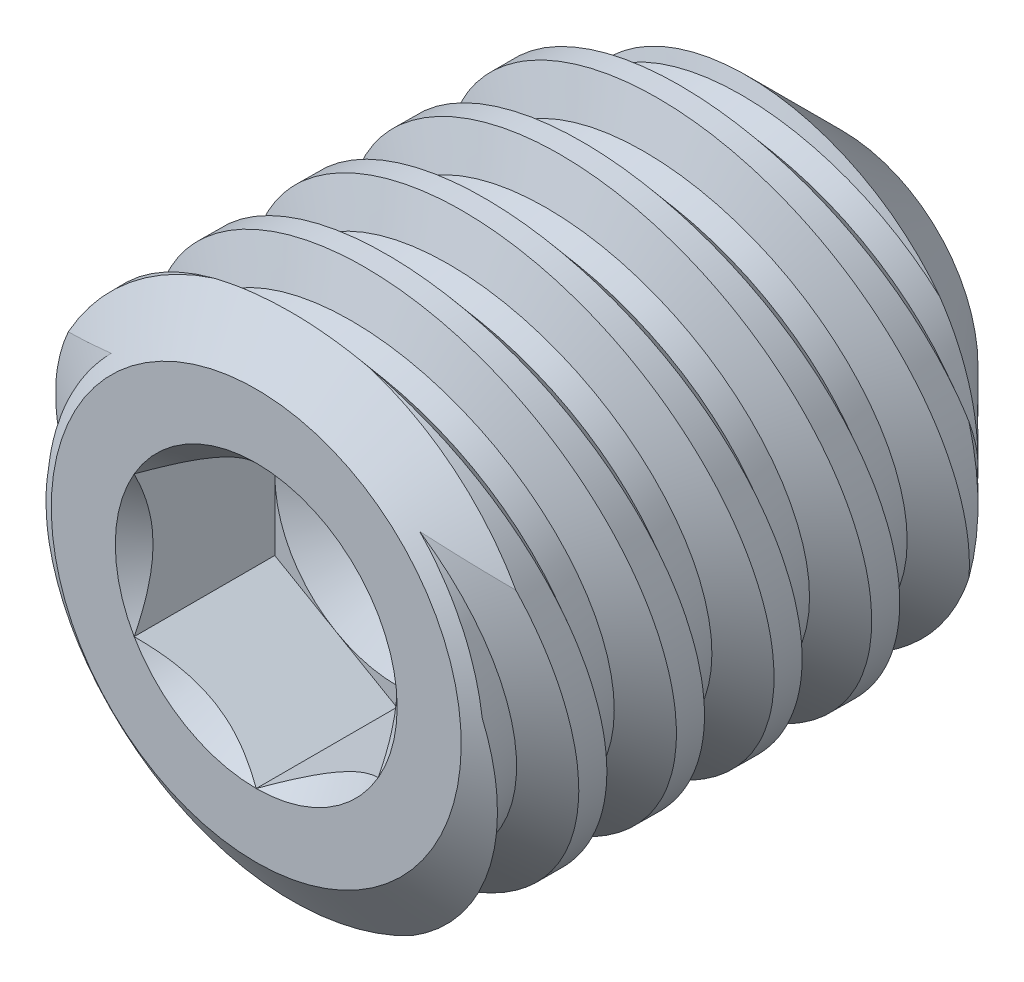
from build123d import *

# Parameters (mm, degrees)
LPATTERN1_COUNT      = 5
LPATTERN1_PITCH      = 0.79375
LPATTERN1_COUNT_DIR2 = 2
LPATTERN1_PITCH_DIR2 = 0.79375
CUT_EXTRUDE10_DEPTH  = 1.143


with BuildPart() as part:
    # Sketch22 → Revolve1 (revolve)
    with BuildSketch(Plane(origin=(0, 0, 0), x_dir=(0, 0, -1), z_dir=(1, 0, 0))):
        Polygon((-2.049304551, 0), (-2.049304551, 1.66624), (-1.757626099, 2.0828), (1.735295449, 2.0828), (2.713195449, 1.1049), (2.049304551, 0), align=None)
    revolve(axis=Axis((0, 0, -2.049304551), (0, 0, -1)))

    # Sketch6 → Cut-Revolve8 (revolve, cut)
    with BuildSketch(Plane(origin=(0, 0, 0), x_dir=(0, 0, -1), z_dir=(1, 0, 0))):
        Polygon((1.103504251, 1.762908932), (0.908574043, 1.725765218), (0.584492784, 2.101371857), (1.266748512, 2.231374854), align=None)
    cut_revolve8 = revolve(axis=Axis((0, 0.162231854, -2.189813218), (0, -0.1871809179215621, 0.9823254572523515)), mode=Mode.SUBTRACT)

    # LPattern1: Cut-Revolve8 5 × 2
    with Locations(*[Vector(0, 0, 1) * (i * LPATTERN1_PITCH) + Vector(0, 0, -1) * (j * LPATTERN1_PITCH_DIR2) for i in range(LPATTERN1_COUNT) for j in range(LPATTERN1_COUNT_DIR2) if (i, j) != (0, 0)]):
        add(cut_revolve8, mode=Mode.SUBTRACT)

    # Sketch23 → Cut-Extrude10 (cut)
    with BuildSketch(Plane.XY.offset(2.049304551)):
        Polygon((0, 1.14567944), (-0.9921875, 0.57283972), (-0.9921875, -0.57283972), (0, -1.14567944), (0.9921875, -0.57283972), (0.9921875, 0.57283972), align=None)
    extrude(amount=-CUT_EXTRUDE10_DEPTH, mode=Mode.SUBTRACT)

    # Cut-Extrude11 cone 1 section (through the dimple's axis) → Cut-Extrude11 (revolve, cut)
    with BuildSketch(Plane(origin=(0, 0, 2.049304551), x_dir=(0, -1, 0), z_dir=(1, 0, 0))):
        Polygon((0, 0), (1.14567944, 0), (0, 1.14567944), align=None)
    revolve(axis=Axis((0, 0, 2.049304551), (0, 0, -1)), mode=Mode.SUBTRACT)

    # Cut-Extrude12 cone 1 section (through the dimple's axis) → Cut-Extrude12 (revolve, cut)
    with BuildSketch(Plane(origin=(0, 0, 0.906304551), x_dir=(0, -1, 0), z_dir=(1, 0, 0))):
        Polygon((0, 0), (0.9921875, 0), (0, 0.596166395), align=None)
    revolve(axis=Axis((0, 0, 0.906304551), (0, 0, -1)), mode=Mode.SUBTRACT)


solid = part.part
